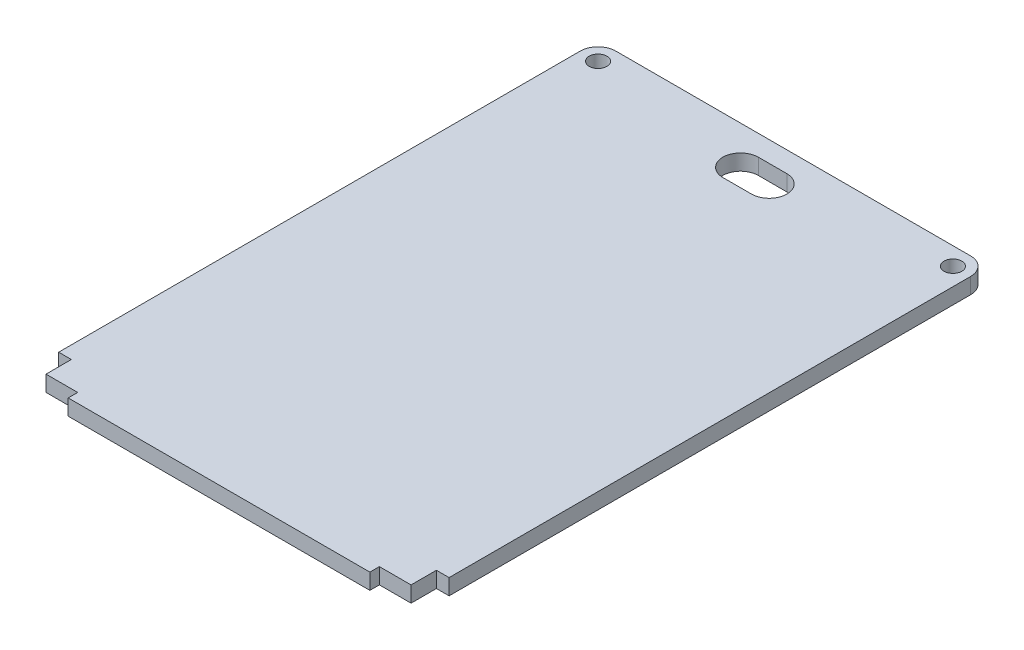
from build123d import *

# Parameters (mm, degrees)
SKETCH1_R           = 1.4
BOSS_EXTRUDE1_DEPTH = 2.5


with BuildPart() as part:
    # Sketch1 → Boss-Extrude1 (new body)
    with BuildSketch(Plane(origin=(0, 25.5, 0), x_dir=(1, 0, 0), z_dir=(0, 1, 0))):
        with BuildLine():
            Line((30.8, 10.2), (30.8, 92.5))
            ThreePointArc((30.8, 92.5), (29.979898987, 94.479898987), (28, 95.3))
            Line((28, 95.3), (-28, 95.3))
            ThreePointArc((-28, 95.3), (-29.979898987, 94.479898987), (-30.8, 92.5))
            Line((-30.8, 92.5), (-30.8, 10.2))
            Line((-30.8, 10.2), (-28.8, 10.2))
            Line((-28.8, 10.2), (-28.8, 6.2))
            Line((-28.8, 6.2), (-23.8, 6.2))
            Line((-23.8, 6.2), (-23.8, 4.7))
            Line((-23.8, 4.7), (23.8, 4.7))
            Line((23.8, 4.7), (23.8, 6.2))
            Line((23.8, 6.2), (28.8, 6.2))
            Line((28.8, 6.2), (28.8, 10.2))
            Line((28.8, 10.2), (30.8, 10.2))
        make_face()
        with Locations((-28, 92.5)):
            Circle(SKETCH1_R, mode=Mode.SUBTRACT)
        with Locations((28, 92.5)):
            Circle(SKETCH1_R, mode=Mode.SUBTRACT)
        with BuildLine():
            Line((2.25, 92.042338074), (-2.25, 92.042338074))
            add(Edge.make_bspline(
                [(-2.25, 92.042338074), (-2.963811395, 92.042338074), (-4.451316042, 91.439501673), (-5.351642078, 89.250801586), (-4.593703384, 87.432133559), (-3.349488153, 86.606824971), (-2.613989561, 86.461364583), (-2.25, 86.461364583)],
                knots=[-1.570796327, -1.570796327, -1.570796327, -1.570796327, -0.785398163, 0, 0.785398163, 1.178097245, 1.570796327, 1.570796327, 1.570796327, 1.570796327], degree=3))
            Line((-2.25, 86.461364583), (2.25, 86.461364583))
            add(Edge.make_bspline(
                [(2.25, 86.461364583), (2.613989561, 86.461364583), (3.349488153, 86.606824971), (4.593703384, 87.432133559), (5.351642078, 89.250801586), (4.451316042, 91.439501673), (2.963811395, 92.042338074), (2.25, 92.042338074)],
                knots=[1.570796327, 1.570796327, 1.570796327, 1.570796327, 1.963495408, 2.35619449, 3.141592654, 3.926990817, 4.71238898, 4.71238898, 4.71238898, 4.71238898], degree=3))
        make_face(mode=Mode.SUBTRACT)
    extrude(amount=BOSS_EXTRUDE1_DEPTH)


solid = part.part
